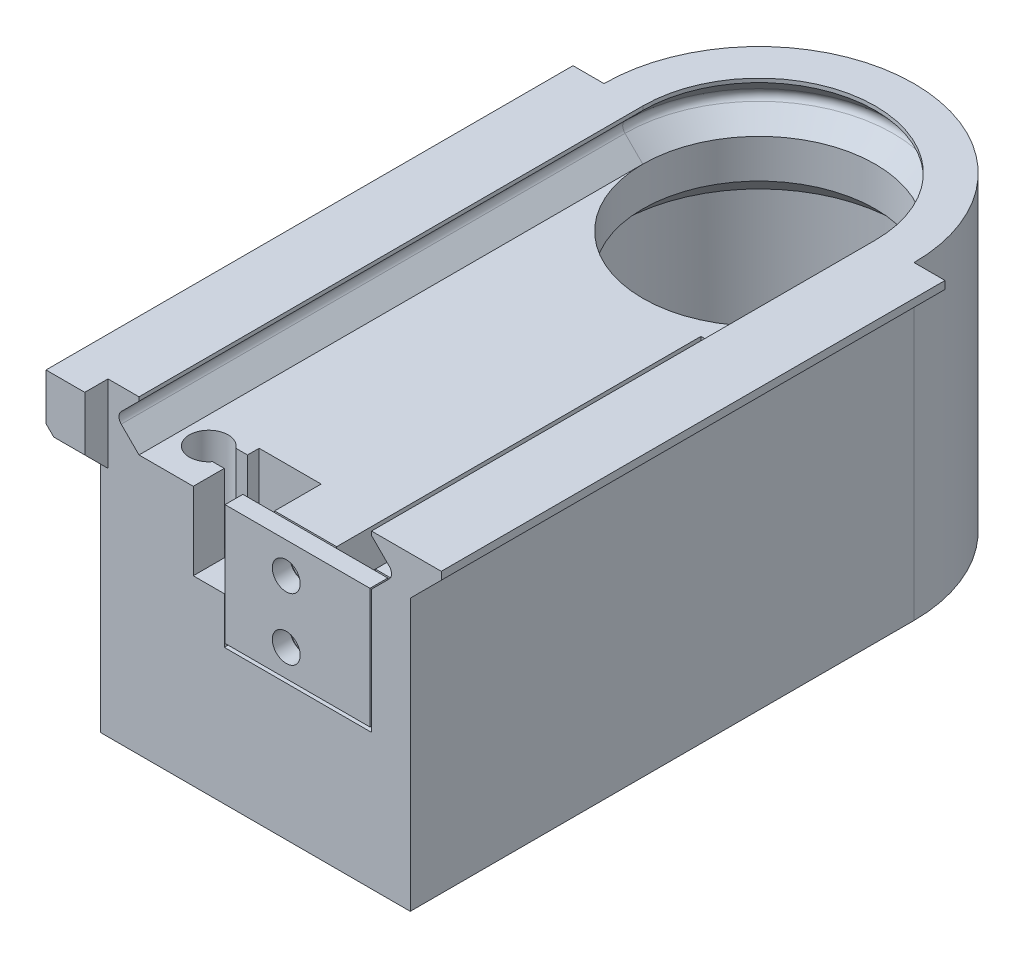
from build123d import *

# Parameters (mm, degrees)
DODANIE_WYCI_GNI_CIE1_DEPTH         = 40
WYTNIJ_WYCI_GNI_CIE1_DEPTH          = 6.5
SZKIC6_R                            = 15
WYTNIJ_WYCI_GNI_CIE2_DEPTH          = 30
SZKIC7_R                            = 18
WYTNIJ_WYCI_GNI_CIE4_DEPTH          = 20
SFAZOWANIE1_SIZE                    = 5
SZKIC8_W                            = 5
SZKIC8_H                            = 47
WYTNIJ_WYCI_GNI_CIE5_DEPTH          = 5
ZAOKR_GLENIE2_R                     = 1
SZKIC10_W                           = 8
SZKIC10_H                           = 6
WYTNIJ_WYCI_GNI_CIE6_DEPTH          = 10
SZKIC11_R                           = 2.5
WYTNIJ_WYCI_GNI_CIE7_DEPTH          = 21
SZKIC12_W                           = 4
SZKIC12_H                           = 2.5
WYTNIJ_WYCI_GNI_CIE8_DEPTH          = 10
DODANIE_WYCI_GNI_CIE2_DEPTH         = 65
SZKIC16_W                           = 5
SZKIC16_H                           = 10
DODANIE_WYCI_GNI_CIE3_DEPTH         = 3
SFAZOWANIE4_SIZE                    = 4
SFAZOWANIE5_SIZE                    = 3
SZKIC17_W                           = 19
SZKIC17_H                           = 2.5
WYTNIJ_WYCI_GNI_CIE9_DEPTH          = 16
OTWORY_USTALAJ_CE_4_0MM5_D          = 4
OTWORY_USTALAJ_CE_4_0MM5_DEPTH      = 15
OTWORY_USTALAJ_CE_4_0MM5_TIP        = 1.201721238
SZKIC23_W                           = 18.7
SZKIC23_H                           = 2.3
DODANIE_WYCI_GNI_CIE4_DEPTH         = 15.5
OTWORY_USTALAJ_CE_4_0MM6_AT_2_COUNT = 2
OTWORY_USTALAJ_CE_4_0MM6_AT_2_PITCH = 8


# Some blends are built 0.0001 mm under size
with BuildPart() as part:
    # Szkic1 → Dodanie-wyciągnięcie1 (new body)
    with BuildSketch(Plane(origin=(0, 0, 0), x_dir=(1, 0, 0), z_dir=(0, 1, 0))):
        with BuildLine():
            ThreePointArc((20, 32.5), (0, 12.5), (-20, 32.5))
            Line((-20, 32.5), (-20, -32.5))
            Line((-20, -32.5), (20, -32.5))
            Line((20, -32.5), (20, 32.5))
        make_face()
        with BuildLine():
            ThreePointArc((20, 32.5), (0, 52.5), (-20, 32.5))
            Line((-20, 32.5), (20, 32.5))
        make_face()
        with BuildLine():
            Line((20, 32.5), (-20, 32.5))
            ThreePointArc((-20, 32.5), (0, 12.5), (20, 32.5))
        make_face()
    extrude(amount=DODANIE_WYCI_GNI_CIE1_DEPTH)

    # Szkic2 → Wytnij-wyciągnięcie1 (cut)
    with BuildSketch(Plane(origin=(0, 40, 0), x_dir=(1, 0, 0), z_dir=(0, 1, 0))):
        with BuildLine():
            Line((-15, -32.5), (15, -32.5))
            Line((15, -32.5), (15, 32.5))
            ThreePointArc((15, 32.5), (0, 47.5), (-15, 32.5))
            Line((-15, 32.5), (-15, -32.5))
        make_face()
    extrude(amount=-WYTNIJ_WYCI_GNI_CIE1_DEPTH, mode=Mode.SUBTRACT)

    # Wycięcie-wyciągnięcie po ścieżce1: sweep along a path in Szkic5
    with BuildLine(Plane(origin=(0, 40, 0), x_dir=(1, 0, 0), z_dir=(0, 1, 0))) as wyci_cie_wyci_gni_cie_po_cie_ce1_path:
        Line((15, -32.5), (15, 32.5))
        ThreePointArc((15, 32.5), (0, 47.5), (-15, 32.5))
        Line((-15, 32.5), (-15, -32.5))
    # Szkic4 → Wycięcie-wyciągnięcie po ścieżce1 (sweep, cut)
    with BuildSketch(Plane.XY.offset(32.5)):
        Polygon((15, 33.5), (18, 36.5), (15, 39.5), align=None)
    sweep(path=wyci_cie_wyci_gni_cie_po_cie_ce1_path.line, mode=Mode.SUBTRACT)

    # Szkic6 → Wytnij-wyciągnięcie2 (cut)
    with BuildSketch(Plane(origin=(0, 33.5, 0), x_dir=(1, 0, 0), z_dir=(0, 1, 0))):
        with Locations(Location((0, 32.5, 0), (0, 0, 270))):
            Circle(SZKIC6_R)
    extrude(amount=-WYTNIJ_WYCI_GNI_CIE2_DEPTH, mode=Mode.SUBTRACT)

    # Szkic7 → Wytnij-wyciągnięcie4 (cut)
    with BuildSketch(Plane(origin=(0, 3.5, 0), x_dir=(1, 0, 0), z_dir=(0, 1, 0))):
        with Locations(Location((0, 32.5, 0), (0, 0, 270))):
            Circle(SZKIC7_R)
    extrude(amount=WYTNIJ_WYCI_GNI_CIE4_DEPTH, mode=Mode.SUBTRACT)

    # Sfazowanie1
    # the kernel refuses this chamfer: 5 mm, written as the material it takes off along each edge
    with BuildSketch(Plane(origin=(0, 23.5, -32.5), x_dir=(0, 0, 1), z_dir=(-1, 0, 0))) as sfazowanie1_piece_1_section:
        Polygon((15, SFAZOWANIE1_SIZE), (15 + SFAZOWANIE1_SIZE, 0), (15, 0), align=None)
    sfazowanie1_piece_1 = revolve(axis=Axis((0, 23.5, -32.5), (0, 1, 0)), mode=Mode.PRIVATE)
    sfazowanie1_piece_1 = sfazowanie1_piece_1 & Plane(origin=(0, 26.996373783, -32.5), x_dir=(0, 0, 1), z_dir=(0, -1, 0)) * Cylinder(18, 81, mode=Mode.PRIVATE)
    add(sfazowanie1_piece_1, mode=Mode.SUBTRACT)

    # Szkic8 → Wytnij-wyciągnięcie5 (cut)
    with BuildSketch(Plane(origin=(0, 33.5, 0), x_dir=(1, 0, 0), z_dir=(0, 1, 0))):
        with Locations((10.5, -6.5)):
            Rectangle(SZKIC8_W, SZKIC8_H)
    extrude(amount=-WYTNIJ_WYCI_GNI_CIE5_DEPTH, mode=Mode.SUBTRACT)

    # Zaokrąglenie2
    zaokr_glenie2_edges = [part.edges().sort_by_distance(p)[0] for p in [
        (18, 36.5, 0),
        (0, 36.5, -50.5),
        (-18, 36.5, 0),
    ]]
    fillet(zaokr_glenie2_edges, radius=ZAOKR_GLENIE2_R)

    # Szkic10 → Wytnij-wyciągnięcie6 (cut)
    with BuildSketch(Plane(origin=(0, 33.5, 0), x_dir=(1, 0, 0), z_dir=(0, 1, 0))):
        with BuildLine():
            ThreePointArc((-9.5, -25.5), (-14, -27), (-9.5, -28.5))
            Line((-9.5, -28.5), (-9.5, -25.5))
        make_face()
        with BuildLine():
            Line((-9.5, -25.5), (-9.5, -28.5))
            ThreePointArc((-9.5, -28.5), (-9.128291755, -27.790569415), (-9, -27))
            ThreePointArc((-9, -27), (-9.128291755, -26.209430585), (-9.5, -25.5))
        make_face()
        with Locations((-4, -27)):
            Rectangle(SZKIC10_W, SZKIC10_H)
        with BuildLine():
            Line((-9.5, -28.5), (-8, -28.5))
            Line((-8, -28.5), (-8, -25.5))
            Line((-8, -25.5), (-9.5, -25.5))
            ThreePointArc((-9.5, -25.5), (-9.128291755, -26.209430585), (-9, -27))
            ThreePointArc((-9, -27), (-9.128291755, -27.790569415), (-9.5, -28.5))
        make_face()
    extrude(amount=-WYTNIJ_WYCI_GNI_CIE6_DEPTH, mode=Mode.SUBTRACT)

    # Szkic11 → Wytnij-wyciągnięcie7 (cut)
    with BuildSketch(Plane(origin=(0, 23.5, 0), x_dir=(1, 0, 0), z_dir=(0, 1, 0))):
        with Locations(Location((-11.5, -27, 0), (0, 0, 270))):
            Circle(SZKIC11_R)
    extrude(amount=-WYTNIJ_WYCI_GNI_CIE7_DEPTH, mode=Mode.SUBTRACT)

    # Szkic12 → Wytnij-wyciągnięcie8 (cut)
    with BuildSketch(Plane(origin=(0, 33.5, 0), x_dir=(1, 0, 0), z_dir=(0, 1, 0))):
        with Locations((-6, -31.25)):
            Rectangle(SZKIC12_W, SZKIC12_H)
    extrude(amount=-WYTNIJ_WYCI_GNI_CIE8_DEPTH, mode=Mode.SUBTRACT)

    # Szkic13 → Dodanie-wyciągnięcie2 (add)
    with BuildSketch(Plane.XY.offset(32.5)):
        Polygon((-20, 40), (-24, 40), (-24, 39), (-20, 35), align=None)
        Polygon((20, 35), (20, 40), (24, 40), (24, 39), align=None)
    extrude(amount=-DODANIE_WYCI_GNI_CIE2_DEPTH)

    # Szkic16 → Dodanie-wyciągnięcie3 (add)
    with BuildSketch(Plane.XY.offset(32.5)):
        with Locations((-21.5, 35)):
            Rectangle(SZKIC16_W, SZKIC16_H)
    extrude(amount=DODANIE_WYCI_GNI_CIE3_DEPTH)

    # Sfazowanie4
    sfazowanie4_edges = [part.edges().sort_by_distance(p)[0] for p in [
        (-24, 30, 34),
    ]]
    chamfer(sfazowanie4_edges, length=SFAZOWANIE4_SIZE)

    # Sfazowanie5
    sfazowanie5_edges = [part.edges().sort_by_distance(p)[0] for p in [
        (-19.5, 30, 35.5),
    ]]
    chamfer(sfazowanie5_edges, length=SFAZOWANIE5_SIZE - 0.0001)  # a hair under: the kernel refuses the full size

    # Szkic17 → Wytnij-wyciągnięcie9 (cut)
    with BuildSketch(Plane(origin=(0, 33.5, 0), x_dir=(1, 0, 0), z_dir=(0, 1, 0))):
        with Locations((5.5, -31.25)):
            Rectangle(SZKIC17_W, SZKIC17_H)
    extrude(amount=-WYTNIJ_WYCI_GNI_CIE9_DEPTH, mode=Mode.SUBTRACT)

    # Otwory ustalające Ø4.0mm5
    with Locations(Plane.XY.offset(30)):
        with Locations((4, 29.5), (4, 21.5)):
            Hole(OTWORY_USTALAJ_CE_4_0MM5_D / 2, depth=OTWORY_USTALAJ_CE_4_0MM5_DEPTH)
            with Locations((0, 0, -(OTWORY_USTALAJ_CE_4_0MM5_DEPTH + OTWORY_USTALAJ_CE_4_0MM5_TIP / 2))):  # 118° drill point
                Cone(0, OTWORY_USTALAJ_CE_4_0MM5_D / 2, OTWORY_USTALAJ_CE_4_0MM5_TIP, mode=Mode.SUBTRACT)


with BuildPart() as body_2:
    # Szkic23 → Dodanie-wyciągnięcie4 (new body)
    with BuildSketch(Plane(origin=(0, 33.5, 0), x_dir=(1, 0, 0), z_dir=(0, 1, 0))):
        with Locations((5.45, -31.35)):
            Rectangle(SZKIC23_W, SZKIC23_H)
    extrude(amount=-DODANIE_WYCI_GNI_CIE4_DEPTH)

    # Szkic25 → Otwory ustalające Ø4.0mm6 (revolve, cut)
    with BuildSketch(Plane(origin=(4, 21.5, 32.5), x_dir=(0, -1, 0), z_dir=(1, 0, 0))):
        Polygon((0, 0), (0, 16.081549114), (1.8, 15), (1.8, 0), align=None)
    otwory_ustalaj_ce_4_0mm6 = revolve(axis=Axis((4, 21.5, 38.85), (0, 0, -1)), mode=Mode.SUBTRACT)

    # Otwory ustalające Ø4.0mm6 at 2: Otwory ustalające Ø4.0mm6 ×2
    with Locations(*[(0, i * OTWORY_USTALAJ_CE_4_0MM6_AT_2_PITCH, 0) for i in range(1, OTWORY_USTALAJ_CE_4_0MM6_AT_2_COUNT)]):
        add(otwory_ustalaj_ce_4_0mm6, mode=Mode.SUBTRACT)


solid = Compound([part.part, body_2.part])
